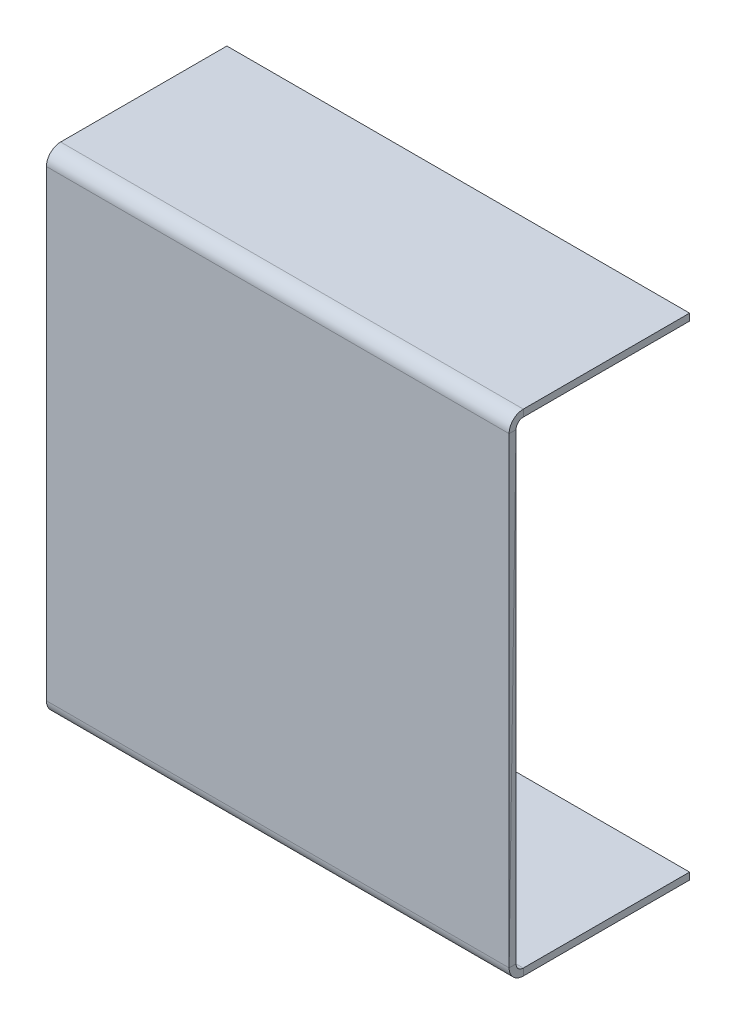
from build123d import *

# Parameters (mm, degrees)
ESQUISSE1_W                 = 101.6
ESQUISSE1_H                 = 101.6
BOSS_EXTRU_1_DEPTH          = 1.524
CONVERTIR_VOLUME3_OUTLINE_W = 101.6
CONVERTIR_VOLUME3_OUTLINE_H = 1.524
CONVERTIR_VOLUME3_DEPTH     = 101.6
T_LE_PLI_E_SUR_AR_TE3_DEPTH = 101.6
T_LE_PLI_E_SUR_AR_TE5_DEPTH = 101.6


# Read off the part's stored shape, not the designer's step: Convertir-Volume3
# Sheet-metal steps are written as plain solids
with BuildPart() as part:
    # Esquisse1 → Boss.-Extru.1 (new body)
    with BuildSketch(Plane.XY):
        with Locations((50.8, 50.8)):
            Rectangle(ESQUISSE1_W, ESQUISSE1_H)
    extrude(amount=BOSS_EXTRU_1_DEPTH)


with BuildPart() as body_2:
    # Convertir-Volume3 outline → Convertir-Volume3 (new body)
    with BuildSketch(Plane.YZ):
        with Locations((50.8, 0.762)):
            Rectangle(CONVERTIR_VOLUME3_OUTLINE_W, CONVERTIR_VOLUME3_OUTLINE_H)
    extrude(amount=CONVERTIR_VOLUME3_DEPTH)

    # Tôle pliée sur arête3 section (across the edge) → Tôle pliée sur arête3 (add)
    with BuildSketch(Plane(origin=(101.6, -1.5875, 0), x_dir=(0, 1, 0), z_dir=(-1, 0, 0))):
        with BuildLine():
            Line((-1.524, 1.5875), (-1.524, 38.1))
            Line((-1.524, 38.1), (0, 38.1))
            Line((0, 38.1), (0, 1.5875))
            ThreePointArc((0, 1.5875), (0.464967985, 0.464967985), (1.5875, 0))
            Line((1.5875, 0), (1.5875, -1.524))
            ThreePointArc((1.5875, -1.524), (-0.61266275, -0.61266275), (-1.524, 1.5875))
        make_face()
    extrude(amount=T_LE_PLI_E_SUR_AR_TE3_DEPTH)

    # Tôle pliée sur arête5 section (across the edge) → Tôle pliée sur arête5 (add)
    with BuildSketch(Plane(origin=(0, 103.1875, 0), x_dir=(0, -1, 0), z_dir=(1, 0, 0))):
        with BuildLine():
            Line((-1.524, 1.5875), (-1.524, 38.1))
            Line((-1.524, 38.1), (0, 38.1))
            Line((0, 38.1), (0, 1.5875))
            ThreePointArc((0, 1.5875), (0.464967985, 0.464967985), (1.5875, 0))
            Line((1.5875, 0), (1.5875, -1.524))
            ThreePointArc((1.5875, -1.524), (-0.61266275, -0.61266275), (-1.524, 1.5875))
        make_face()
    extrude(amount=T_LE_PLI_E_SUR_AR_TE5_DEPTH)


solid = Compound([part.part, body_2.part])
